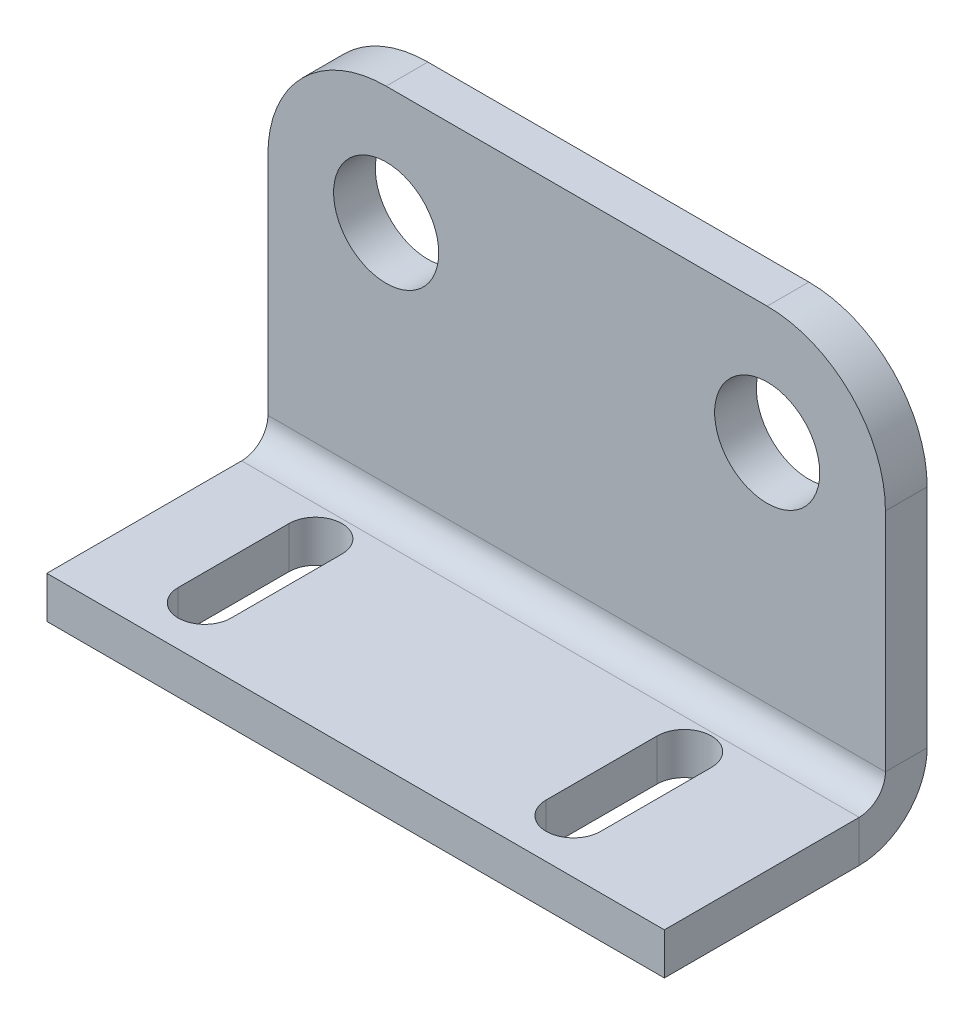
from build123d import *

# Parameters (mm, degrees)
CROQUIS1_R                = 10
SALIENTE_EXTRUIR1_DEPTH   = 7.9375
CROQUIS3_W                = 117.5
CROQUIS3_H                = 50
SALIENTE_EXTRUIR2_DEPTH   = 7.9375
CONVERTIR_S_LIDO1_START   = -58.75
CONVERTIR_S_LIDO1_DEPTH   = 117.5
CONVERTIR_S_LIDO1_2_DEPTH = 117.5


# Read off the part's stored shape, not the designer's step: Convertir-Sólido1
with BuildPart() as part:
    # Croquis1 → Saliente-Extruir1 (new body)
    with BuildSketch(Plane.XY):
        with BuildLine():
            ThreePointArc((58.75, 0), (52.159902577, 15.909902577), (36.25, 22.5))
            Line((36.25, 22.5), (-36.25, 22.5))
            ThreePointArc((-36.25, 22.5), (-52.159902577, 15.909902577), (-58.75, 0))
            Line((-58.75, 0), (-58.75, -47.992399286))
            Line((-58.75, -47.992399286), (58.75, -47.992399286))
            Line((58.75, -47.992399286), (58.75, 0))
        make_face()
        with Locations((-36.25, 0)):
            Circle(CROQUIS1_R, mode=Mode.SUBTRACT)
        with Locations((36.25, 0)):
            Circle(CROQUIS1_R, mode=Mode.SUBTRACT)
    extrude(amount=SALIENTE_EXTRUIR1_DEPTH)

    # Croquis3 → Saliente-Extruir2 (add)
    with BuildSketch(Plane.XZ.offset(47.992399286)):
        with Locations((0, 25)):
            Rectangle(CROQUIS3_W, CROQUIS3_H)
        with BuildLine():
            Line((-33.847495585, 39.845079108), (-33.847495585, 18.753600712))
            ThreePointArc((-33.847495585, 18.753600712), (-38.88030023, 13.720796067), (-43.913104875, 18.753600712))
            Line((-43.913104875, 18.753600712), (-43.913104875, 39.845079108))
            ThreePointArc((-43.913104875, 39.845079108), (-38.88030023, 44.877883753), (-33.847495585, 39.845079108))
        make_face(mode=Mode.SUBTRACT)
        with BuildLine():
            Line((36.463745774, 39.845079108), (36.463745774, 18.753600712))
            ThreePointArc((36.463745774, 18.753600712), (31.282917463, 13.572772401), (26.102089152, 18.753600712))
            Line((26.102089152, 18.753600712), (26.102089152, 39.845079108))
            ThreePointArc((26.102089152, 39.845079108), (31.282917463, 45.025907419), (36.463745774, 39.845079108))
        make_face(mode=Mode.SUBTRACT)
    extrude(amount=SALIENTE_EXTRUIR2_DEPTH)

    # Convertir-Sólido1 outline → Convertir-Sólido1 (cut)
    with BuildSketch(Plane.YZ.offset(CONVERTIR_S_LIDO1_START)):
        with BuildLine():
            ThreePointArc((-42.992399286, 0), (-52.140593268, 3.789306019), (-55.929899286, 12.9375))
            Line((-55.929899286, 12.9375), (-55.929899286, 0))
            Line((-55.929899286, 0), (-42.992399286, 0))
        make_face()
    extrude(amount=CONVERTIR_S_LIDO1_DEPTH, mode=Mode.SUBTRACT)

    # Convertir-S_lido1 2 outline → Convertir-S_lido1 2 (add)
    with BuildSketch(Plane.YZ.offset(CONVERTIR_S_LIDO1_START)):
        with BuildLine():
            ThreePointArc((-42.992399286, 7.9375), (-46.527933192, 9.401966094), (-47.992399286, 12.9375))
            Line((-47.992399286, 12.9375), (-47.992399286, 7.9375))
            Line((-47.992399286, 7.9375), (-42.992399286, 7.9375))
        make_face()
    extrude(amount=CONVERTIR_S_LIDO1_2_DEPTH)


solid = part.part
